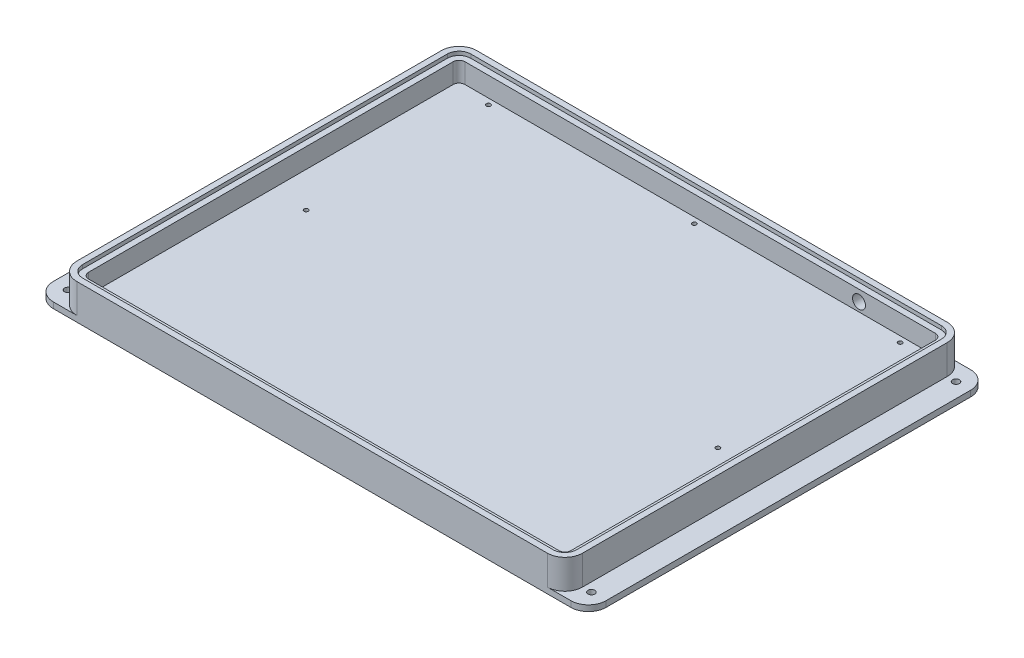
from build123d import *

# Parameters (mm, degrees)
SKETCH1_W           = 273.05
SKETCH1_H           = 215.9
BOSS_EXTRUDE1_DEPTH = 19.05
FILLET1_R           = 9.525
CUT_EXTRUDE1_DEPTH  = 12.7
CUT_EXTRUDE2_DEPTH  = 2.032
SKETCH5_R           = 1.1303
CUT_EXTRUDE3_DEPTH  = 4.7625
SKETCH6_R           = 3.4925
CUT_EXTRUDE4_DEPTH  = 12.7
BOSS_EXTRUDE2_DEPTH = 3.175
SKETCH8_R           = 1.8288
CUT_EXTRUDE5_DEPTH  = 359.493916441


with BuildPart() as part:
    # Sketch1 → Boss-Extrude1 (new body)
    with BuildSketch(Plane(origin=(0, 0, 0), x_dir=(1, 0, 0), z_dir=(0, 1, 0))):
        with Locations((136.525, 107.95)):
            Rectangle(SKETCH1_W, SKETCH1_H)
    extrude(amount=BOSS_EXTRUDE1_DEPTH)

    # Fillet1
    fillet1_edges = [part.edges().sort_by_distance(p)[0] for p in [
        (273.05, 9.525, 0),
        (273.05, 9.525, -215.9),
        (0, 9.525, 0),
        (0, 9.525, -215.9),
    ]]
    fillet(fillet1_edges, radius=FILLET1_R)

    # Sketch3 → Cut-Extrude1 (cut)
    with BuildSketch(Plane(origin=(0, 19.05, 0), x_dir=(1, 0, 0), z_dir=(0, 1, 0))):
        with BuildLine():
            Line((266.7, 9.525), (266.7, 206.375))
            ThreePointArc((266.7, 206.375), (265.77006403, 208.62006403), (263.525, 209.55))
            Line((263.525, 209.55), (9.525, 209.55))
            ThreePointArc((9.525, 209.55), (7.27993597, 208.62006403), (6.35, 206.375))
            Line((6.35, 206.375), (6.35, 9.525))
            ThreePointArc((6.35, 9.525), (7.27993597, 7.27993597), (9.525, 6.35))
            Line((9.525, 6.35), (263.525, 6.35))
            ThreePointArc((263.525, 6.35), (265.77006403, 7.27993597), (266.7, 9.525))
        make_face()
    extrude(amount=-CUT_EXTRUDE1_DEPTH, mode=Mode.SUBTRACT)

    # Sketch4 → Cut-Extrude2 (cut)
    with BuildSketch(Plane(origin=(0, 19.05, 0), x_dir=(1, 0, 0), z_dir=(0, 1, 0))):
        with BuildLine():
            Line((269.875, 9.525), (269.875, 206.375))
            ThreePointArc((269.875, 206.375), (268.015128061, 210.865128061), (263.525, 212.725))
            Line((263.525, 212.725), (9.525, 212.725))
            ThreePointArc((9.525, 212.725), (5.034871939, 210.865128061), (3.175, 206.375))
            Line((3.175, 206.375), (3.175, 9.525))
            ThreePointArc((3.175, 9.525), (5.034871939, 5.034871939), (9.525, 3.175))
            Line((9.525, 3.175), (263.525, 3.175))
            ThreePointArc((263.525, 3.175), (268.015128061, 5.034871939), (269.875, 9.525))
        make_face()
    extrude(amount=-CUT_EXTRUDE2_DEPTH, mode=Mode.SUBTRACT)

    # Sketch5 → Cut-Extrude3 (cut)
    with BuildSketch(Plane(origin=(0, 6.35, 0), x_dir=(1, 0, 0), z_dir=(0, 1, 0))):
        with Locations((25.4, 206.375)):
            Circle(SKETCH5_R)
        with Locations((136.525, 206.375)):
            Circle(SKETCH5_R)
        with Locations((247.65, 206.375)):
            Circle(SKETCH5_R)
        with Locations((247.65, 107.95)):
            Circle(SKETCH5_R)
        with Locations((25.4, 107.95)):
            Circle(SKETCH5_R)
        with Locations((25.4, 9.525)):
            Circle(SKETCH5_R)
        with Locations((136.525, 9.525)):
            Circle(SKETCH5_R)
        with Locations((247.65, 9.525)):
            Circle(SKETCH5_R)
    extrude(amount=-CUT_EXTRUDE3_DEPTH, mode=Mode.SUBTRACT)

    # Sketch6 → Cut-Extrude4 (cut)
    with BuildSketch(Plane(origin=(0, 0, -215.9), x_dir=(-1, 0, 0), z_dir=(0, 0, -1))):
        with Locations((-222.25, 11.1125)):
            Circle(SKETCH6_R)
    extrude(amount=-CUT_EXTRUDE4_DEPTH, mode=Mode.SUBTRACT)

    # Sketch7 → Boss-Extrude2 (add)
    with BuildSketch(Plane.XZ):
        with BuildLine():
            Line((-3.175, 0), (276.225, 0))
            ThreePointArc((276.225, 0), (282.960192091, -2.789807909), (285.75, -9.525))
            Line((285.75, -9.525), (285.75, -206.375))
            ThreePointArc((285.75, -206.375), (282.960192091, -213.110192091), (276.225, -215.9))
            Line((276.225, -215.9), (-3.175, -215.9))
            ThreePointArc((-3.175, -215.9), (-9.910192091, -213.110192091), (-12.7, -206.375))
            Line((-12.7, -206.375), (-12.7, -9.525))
            ThreePointArc((-12.7, -9.525), (-9.910192091, -2.789807909), (-3.175, 0))
        make_face()
    extrude(amount=-BOSS_EXTRUDE2_DEPTH)

    # Sketch8 → Cut-Extrude5 (cut, through all)
    with BuildSketch(Plane(origin=(0, 3.175, 0), x_dir=(1, 0, 0), z_dir=(0, 1, 0))):
        with Locations((-4.7625, 206.375)):
            Circle(SKETCH8_R)
        with Locations((-4.7625, 9.525)):
            Circle(SKETCH8_R)
        with Locations((277.8125, 9.525)):
            Circle(SKETCH8_R)
        with Locations((277.8125, 206.375)):
            Circle(SKETCH8_R)
    extrude(amount=-CUT_EXTRUDE5_DEPTH, mode=Mode.SUBTRACT)


solid = part.part
